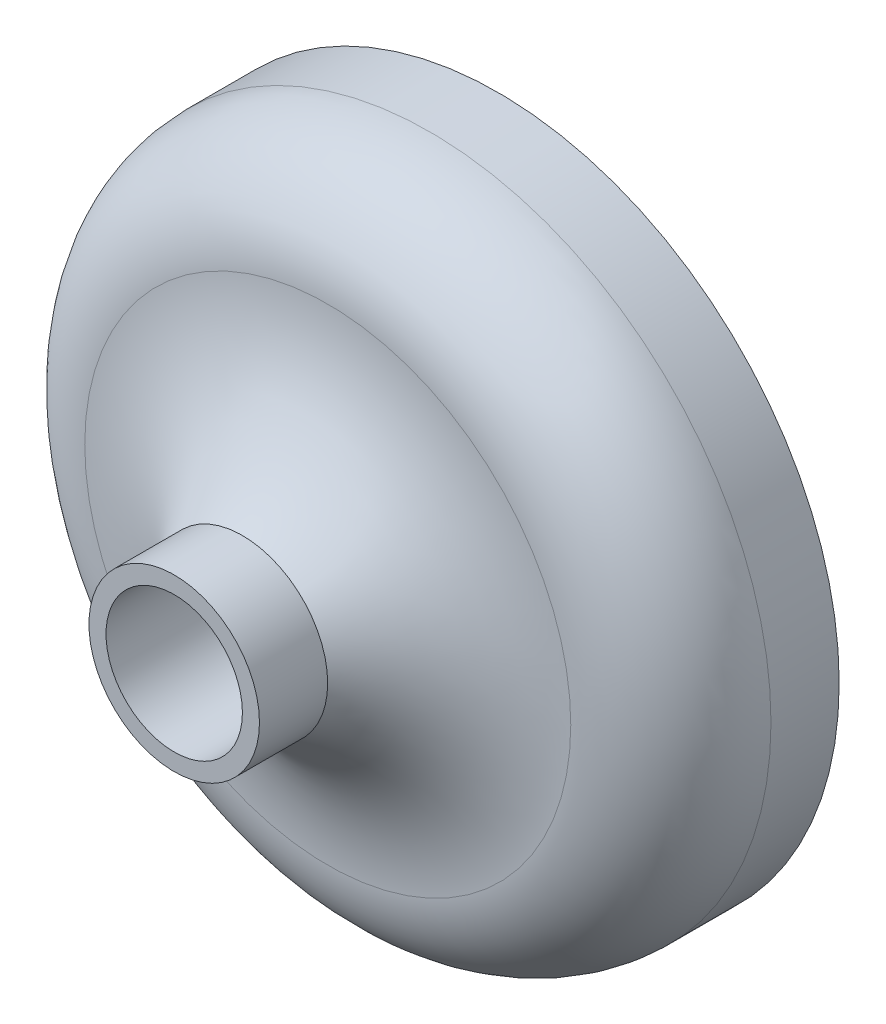
from build123d import *

# Parameters (mm, degrees)
SKETCH1_R           = 100
SKETCH1_R_2         = 95
BOSS_EXTRUDE1_DEPTH = 25
SKETCH2_R           = 100
BOSS_EXTRUDE2_DEPTH = 25
SKETCH3_R           = 20
CUT_EXTRUDE1_DEPTH  = 25
BOSS_EXTRUDE3_START = 25
SKETCH4_R           = 25
SKETCH4_R_2         = 20
BOSS_EXTRUDE3_DEPTH = 25
FILLET1_R           = 30
FILLET2_R           = 120
FILLET3_R           = 60
BOSS_EXTRUDE4_START = 20
SKETCH5_R           = 25
SKETCH5_R_2         = 20
BOSS_EXTRUDE4_DEPTH = 20


with BuildPart() as part:
    # Sketch1 → Boss-Extrude1 (new body)
    with BuildSketch(Plane.XY):
        Circle(SKETCH1_R)
        Circle(SKETCH1_R_2, mode=Mode.SUBTRACT)
    extrude(amount=BOSS_EXTRUDE1_DEPTH)

    # Sketch2 → Boss-Extrude2 (add)
    with BuildSketch(Plane.XY.offset(25)):
        Circle(SKETCH2_R)
    extrude(amount=BOSS_EXTRUDE2_DEPTH)

    # Sketch3 → Cut-Extrude1 (cut)
    with BuildSketch(Plane.XY.offset(50)):
        Circle(SKETCH3_R)
    extrude(amount=-CUT_EXTRUDE1_DEPTH, mode=Mode.SUBTRACT)

    # Sketch4 → Boss-Extrude3 (add)
    with BuildSketch(Plane.XY.offset(50).offset(BOSS_EXTRUDE3_START)):
        Circle(SKETCH4_R)
        Circle(SKETCH4_R_2, mode=Mode.SUBTRACT)
    extrude(amount=-BOSS_EXTRUDE3_DEPTH)

    # Fillet1
    fillet1_edges = [part.edges().sort_by_distance(p)[0] for p in [
        (-100, 0, 50),
    ]]
    fillet(fillet1_edges, radius=FILLET1_R)

    # Fillet2
    # the kernel refuses this fillet: 120 mm, written as the material it adds along each edge
    with BuildSketch(Plane(origin=(0, 0, 25), x_dir=(1, 0, 0), z_dir=(0, -1, 0))) as fillet2_piece_1:
        with BuildLine():
            CenterArc((21.685608507, -120), FILLET2_R, 52.341537994, 37.658462006)
            Line((21.685608507, 0), (21.685608507, 2.4))
            Line((21.685608507, 2.4), (95, 2.4))
            Line((95, 2.4), (97.4, 0))
            ThreePointArc((97.4, 0), (97.4, -12.5), (96.46628783, -23.1))
            Line((96.46628783, -23.1), (95, -25))
        make_face()
    revolve(axis=Axis((0, 0, 25), (0, 0, 1)))

    # Fillet3
    # the kernel refuses this fillet: 60 mm, written as the material it adds along each edge
    with BuildSketch(Plane(origin=(0, 0, 50), x_dir=(1, 0, 0), z_dir=(0, -1, 0))) as fillet3_piece_1_section:
        with BuildLine():
            CenterArc((73.791247331, 59.920111453), FILLET3_R, 215.59146616, 51.994236434)
            Line((71.26374911, -0.026629516), (71.010999288, -6.021303613))
            ThreePointArc((71.010999288, -6.021303613), (70, -6), (25, -6))
            Line((25, -6), (19, 0))
            ThreePointArc((19, 0), (19, 12.5), (20.120875267, 21.507988855))
            Line((20.120875267, 21.507988855), (25, 25))
        make_face()
    fillet3_piece_1 = revolve(axis=Axis((0, 0, 50), (0, 0, 1)), mode=Mode.PRIVATE)
    fillet3_piece_1 = fillet3_piece_1 - Plane(origin=(0, 0, 57.041337481), x_dir=(1, 0, 0), z_dir=(0, 0, 1)) * Cylinder(20, 286, mode=Mode.PRIVATE)
    add(fillet3_piece_1)

    # Sketch5 → Boss-Extrude4 (add)
    with BuildSketch(Plane.XY.offset(75).offset(BOSS_EXTRUDE4_START)):
        Circle(SKETCH5_R)
        Circle(SKETCH5_R_2, mode=Mode.SUBTRACT)
    extrude(amount=-BOSS_EXTRUDE4_DEPTH)


solid = part.part
